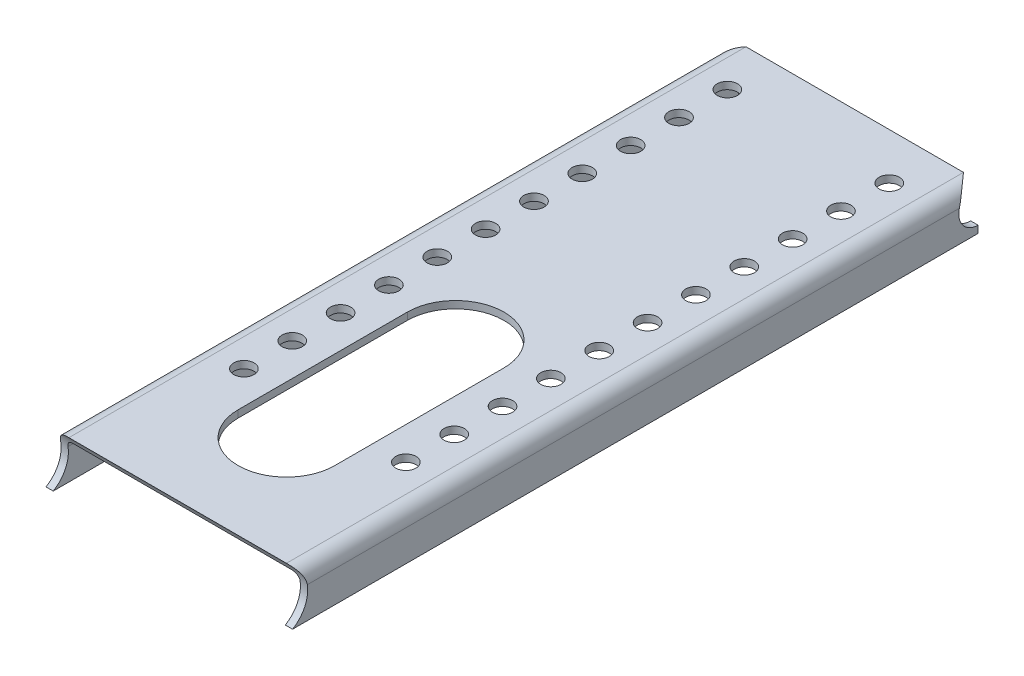
from build123d import *

# Parameters (mm, degrees)
SKETCH1_W                   = 90
SKETCH1_H                   = 290
BASE_FLANGE1_DEPTH          = 3
SM_EDGE_FLANGE_1_DEPTH      = 290
SM_EDGE_FLANGE_1_BEND_DEPTH = 290
INDENT1_START               = 23
INDENT1_DEPTH               = 104
INDENT1_START_2             = 26.270388893
INDENT1_2_DEPTH             = 97.459222009
INDENT1_3_DEPTH             = 0.729611107
INDENT1_START_3             = 123
INDENT1_4_DEPTH             = 0.729610902
INDENT1_START_4             = 119.9999999
INDENT1_5_DEPTH             = 6.0000001
INDENT1_START_5             = 24
INDENT1_6_DEPTH             = 6
INDENT1_START_6             = -290
INDENT1_7_DEPTH             = 6.65
INDENT2_START               = 23
INDENT2_DEPTH               = 104
INDENT2_START_2             = -11.0000001
INDENT2_2_DEPTH             = 11.0000001
INDENT2_START_3             = 24
INDENT2_3_DEPTH             = 102
CUT_EXTRUDE1_DEPTH          = 317.754179273
CUT_EXTRUDE1_DEPTH_BACK     = 317.754179273
SKETCH15_R                  = 4.2
CUT_EXTRUDE2_DEPTH          = 317.754179273
CUT_EXTRUDE2_DEPTH_BACK     = 317.754179273


with BuildPart() as part:
    # Base-Flange1: sheet metal written as solids
    # Sketch1 → Base-Flange1 (new body)
    with BuildSketch(Plane(origin=(0, 207.95, 0), x_dir=(1, 0, 0), z_dir=(0, 1, 0))):
        with Locations((75, 145)):
            Rectangle(SKETCH1_W, SKETCH1_H)
    extrude(amount=-BASE_FLANGE1_DEPTH)

    # 邊線-凸緣1: sheet metal written as solids
    # 邊線-凸緣1 section (on a plane across the edge) → 邊線-凸緣1 (add)
    with BuildSketch(Plane(origin=(27, 204.95, 0), x_dir=(1, 0, 0), z_dir=(0, 0, -1))):
        with BuildLine():
            Line((-3, 3), (-3, 15.9))
            Line((-3, 15.9), (0, 15.9))
            Line((0, 15.9), (0, 3))
            ThreePointArc((0, 3), (0.878679656, 0.878679656), (3, 0))
            Line((3, 0), (3, -3))
            ThreePointArc((3, -3), (-1.242640687, -1.242640687), (-3, 3))
        make_face()
    extrude(amount=SM_EDGE_FLANGE_1_DEPTH)

    # 邊線-凸緣1 section 2 (on a plane across the edge) → 邊線-凸緣1 bend (add)
    with BuildSketch(Plane(origin=(123, 204.95, -290), x_dir=(-1, 0, 0), z_dir=(0, 0, 1))):
        with BuildLine():
            Line((-3, 3), (-3, 15.9))
            Line((-3, 15.9), (0, 15.9))
            Line((0, 15.9), (0, 3))
            ThreePointArc((0, 3), (0.878679656, 0.878679656), (3, 0))
            Line((3, 0), (3, -3))
            ThreePointArc((3, -3), (-1.242640687, -1.242640687), (-3, 3))
        make_face()
    extrude(amount=SM_EDGE_FLANGE_1_BEND_DEPTH)

    # Indent1: read off the stored shape, not the designer's step
    # Indent1 outline → Indent1 (cut)
    with BuildSketch(Plane.YZ.offset(INDENT1_START)):
        with BuildLine():
            Line((192.05, -290), (207.95, -290))
            ThreePointArc((207.95, -290), (200, -282.05), (192.05, -290))
        make_face()
    extrude(amount=INDENT1_DEPTH, mode=Mode.SUBTRACT)

    # Indent2: read off the stored shape, not the designer's step
    # Indent2 outline → Indent2 (cut)
    with BuildSketch(Plane.YZ.offset(INDENT2_START)):
        with BuildLine():
            ThreePointArc((189.05, -6.433311744), (197.7062633, -12.491147744), (207.950014124, -9.903902031))
            Line((207.950014124, -9.903902031), (209, -9.061062257))
            Line((209, -9.061062257), (209, 1))
            Line((209, 1), (188, 1))
            Line((188, 1), (188, 0))
            Line((188, 0), (188, -4.64612958))
            Line((188, -4.64612958), (189.05, -6.433311744))
        make_face()
    extrude(amount=INDENT2_DEPTH, mode=Mode.SUBTRACT)

    # Sketch15 → Cut-Extrude1 (cut, two sides: drawn at the far end of the back side and taken through both)
    with BuildSketch(Plane(origin=(0, 207.95, 0), x_dir=(1, 0, 0), z_dir=(0, 1, 0)).offset(-CUT_EXTRUDE1_DEPTH_BACK)):
        with Locations((41.5, 270.8)):
            Circle(SKETCH15_R)
        with Locations((108.5, 270.8)):
            Circle(SKETCH15_R)
        with Locations((41.5, 250.8)):
            Circle(SKETCH15_R)
        with Locations((108.5, 250.8)):
            Circle(SKETCH15_R)
        with Locations((41.5, 230.8)):
            Circle(SKETCH15_R)
        with Locations((108.5, 230.8)):
            Circle(SKETCH15_R)
        with Locations((41.5, 210.8)):
            Circle(SKETCH15_R)
        with Locations((108.5, 210.8)):
            Circle(SKETCH15_R)
        with Locations((41.5, 190.8)):
            Circle(SKETCH15_R)
        with Locations((108.5, 190.8)):
            Circle(SKETCH15_R)
        with Locations((41.5, 170.8)):
            Circle(SKETCH15_R)
        with Locations((108.5, 170.8)):
            Circle(SKETCH15_R)
        with Locations((41.5, 150.8)):
            Circle(SKETCH15_R)
        with Locations((108.5, 150.8)):
            Circle(SKETCH15_R)
        with Locations((41.5, 130.8)):
            Circle(SKETCH15_R)
        with Locations((108.5, 130.8)):
            Circle(SKETCH15_R)
        with Locations((41.5, 110.8)):
            Circle(SKETCH15_R)
        with Locations((108.5, 110.8)):
            Circle(SKETCH15_R)
        with Locations((41.5, 90.8)):
            Circle(SKETCH15_R)
        with Locations((108.5, 90.8)):
            Circle(SKETCH15_R)
        with Locations((41.5, 70.8)):
            Circle(SKETCH15_R)
        with Locations((108.5, 70.8)):
            Circle(SKETCH15_R)
    extrude(amount=CUT_EXTRUDE1_DEPTH + CUT_EXTRUDE1_DEPTH_BACK, mode=Mode.SUBTRACT)

    # Sketch16 → Cut-Extrude2 (cut, two sides: drawn at the far end of the back side and taken through both)
    with BuildSketch(Plane(origin=(0, 207.95, 0), x_dir=(1, 0, 0), z_dir=(0, 1, 0)).offset(-CUT_EXTRUDE2_DEPTH_BACK)):
        with BuildLine():
            Line((55, 54.903913368), (55, 124.903913368))
            ThreePointArc((55, 124.903913368), (75, 144.903913368), (95, 124.903913368))
            Line((95, 124.903913368), (95, 54.903913368))
            ThreePointArc((95, 54.903913368), (75, 34.903913368), (55, 54.903913368))
        make_face()
    extrude(amount=CUT_EXTRUDE2_DEPTH + CUT_EXTRUDE2_DEPTH_BACK, mode=Mode.SUBTRACT)


with BuildPart() as body_2:
    # Indent1 2 outline → Indent1 2 (new body)
    with BuildSketch(Plane.YZ.offset(INDENT1_START_2)):
        with BuildLine():
            Line((204.95, -285.559279338), (204.95, -290))
            Line((204.95, -290), (206.65, -290))
            ThreePointArc((206.65, -290), (206.210475022, -287.622501314), (204.95, -285.559279338))
        make_face()
    extrude(amount=INDENT1_2_DEPTH)

    # Indent1 3 outline → Indent1 3 (add)
    with BuildSketch(Plane.YZ.offset(INDENT1_START_2)):
        with BuildLine():
            Line((193.35, -290), (204.95, -290))
            Line((204.95, -290), (204.95, -285.559279338))
            ThreePointArc((204.95, -285.559279338), (197.622501314, -283.789524978), (193.35, -290))
        make_face()
    extrude(amount=INDENT1_3_DEPTH)

    # Indent1 4 outline → Indent1 4 (add)
    with BuildSketch(Plane.YZ.offset(INDENT1_START_3)):
        with BuildLine():
            Line((193.35, -290), (204.95, -290))
            Line((204.95, -290), (204.95, -285.559279338))
            ThreePointArc((204.95, -285.559279338), (197.622501314, -283.789524978), (193.35, -290))
        make_face()
    extrude(amount=INDENT1_4_DEPTH)

    # Indent1 5 outline → Indent1 5 (add)
    with BuildSketch(Plane.YZ.offset(INDENT1_START_4)):
        with BuildLine():
            Line((193.35, -290), (206.65, -290))
            ThreePointArc((206.65, -290), (200, -283.35), (193.35, -290))
        make_face()
    extrude(amount=INDENT1_5_DEPTH)

    # Indent1 6 outline → Indent1 6 (add)
    with BuildSketch(Plane.YZ.offset(INDENT1_START_5)):
        with BuildLine():
            Line((193.35, -290), (206.65, -290))
            ThreePointArc((206.65, -290), (200, -283.35), (193.35, -290))
        make_face()
    extrude(amount=INDENT1_6_DEPTH)

    # Indent1 7 outline → Indent1 7 (cut)
    with BuildSketch(Plane.XY.offset(INDENT1_START_6)):
        with BuildLine():
            Line((123, 192), (123, 201.95))
            ThreePointArc((123, 201.95), (122.121320344, 204.071320344), (120, 204.95))
            Line((120, 204.95), (119.9999999, 192))
            Line((119.9999999, 192), (123, 192))
        make_face()
        with BuildLine():
            Line((27, 192), (30, 192))
            Line((30, 192), (30, 204.95))
            ThreePointArc((30, 204.95), (27.878679656, 204.071320344), (27, 201.95))
            Line((27, 201.95), (27, 192))
        make_face()
        with BuildLine():
            ThreePointArc((123.729603466, 206.650006169), (125.402666971, 204.559825589), (126, 201.95))
            Line((126, 201.95), (126, 208))
            Line((126, 208), (122.028355761, 208))
            Line((122.028355761, 208), (123.729603466, 206.650006169))
        make_face()
        with BuildLine():
            Line((24, 208), (24, 201.95))
            ThreePointArc((24, 201.95), (24.597331636, 204.559822705), (26.270391517, 206.650002187))
            Line((26.270391517, 206.650002187), (27.971640511, 208))
            Line((27.971640511, 208), (24, 208))
        make_face()
    extrude(amount=INDENT1_7_DEPTH, mode=Mode.SUBTRACT)


with BuildPart() as body_3:
    # Indent2 2 outline → Indent2 2 (new body)
    with BuildSketch(Plane.XY.offset(INDENT2_START_2)):
        with BuildLine():
            Line((24, 201.95), (24, 189.05))
            Line((24, 189.05), (27, 189.05))
            Line((27, 189.05), (27, 201.95))
            ThreePointArc((27, 201.95), (27.878679656, 204.071320344), (30, 204.95))
            Line((30, 204.95), (120, 204.95))
            ThreePointArc((120, 204.95), (122.121320344, 204.071320344), (123, 201.95))
            Line((123, 201.95), (123, 189.05))
            Line((123, 189.05), (126, 189.05))
            Line((126, 189.05), (126, 201.95))
            ThreePointArc((126, 201.95), (124.242640687, 206.192640687), (120, 207.95))
            Line((120, 207.95), (30, 207.95))
            ThreePointArc((30, 207.95), (25.757359313, 206.192640687), (24, 201.95))
        make_face()
    extrude(amount=INDENT2_2_DEPTH)

    # Indent2 3 outline → Indent2 3 (cut)
    with BuildSketch(Plane.YZ.offset(INDENT2_START_3)):
        with BuildLine():
            Line((207.95, -11.0000001), (207.950016725, -7.602449216))
            ThreePointArc((207.950016725, -7.602449216), (204.322791843, -10.115012145), (200.000000001, -11))
            Line((200.000000001, -11), (207.95, -11.0000001))
        make_face()
        with BuildLine():
            Line((189.05, -11.0000001), (200.000000001, -11))
            ThreePointArc((200.000000001, -11), (192.601479194, -8.140140655), (189.05, -1.047616342))
            Line((189.05, -1.047616342), (189.05, -11.0000001))
        make_face()
    extrude(amount=INDENT2_3_DEPTH, mode=Mode.SUBTRACT)


solid = part.part
